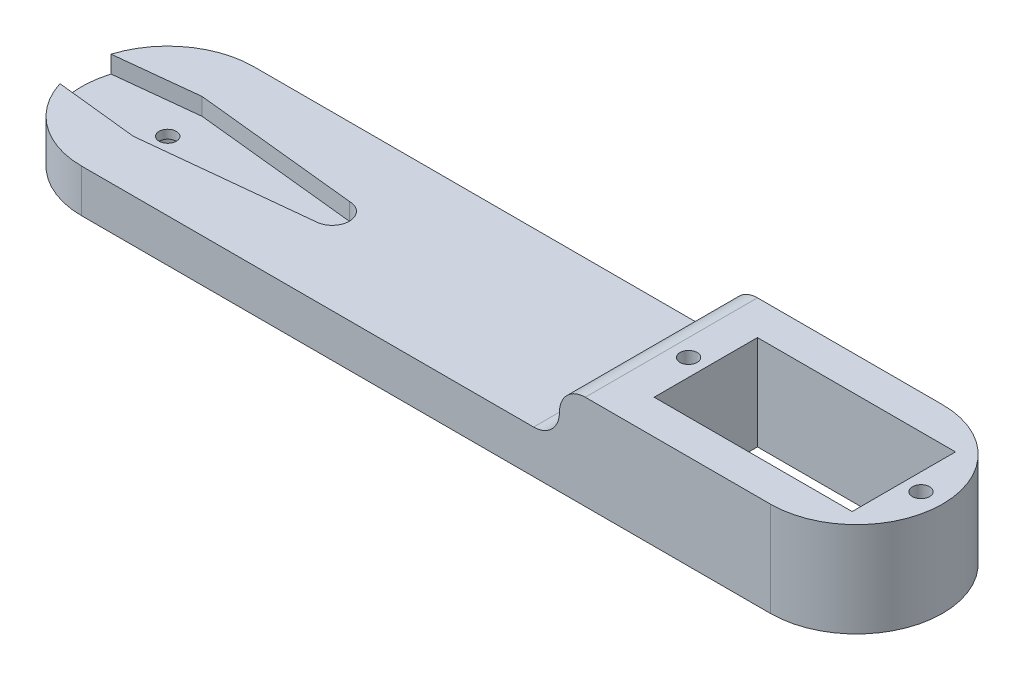
from build123d import *

# Parameters (mm, degrees)
BOSS_EXTRUDE1_DEPTH = 5
CUT_EXTRUDE1_START  = -2
CUT_EXTRUDE1_DEPTH  = 2
CUT_EXTRUDE2_DEPTH  = 52.23475383
SKETCH4_R           = 3
CUT_EXTRUDE3_DEPTH  = 2
SKETCH5_W           = 17.5
SKETCH5_H           = 12
SKETCH5_W_2         = 5.5
SKETCH5_R           = 1
CUT_EXTRUDE4_DEPTH  = 52.23475383
BOSS_EXTRUDE2_START = 6
SKETCH6_R           = 1
SKETCH6_W           = 23
SKETCH6_H           = 12
BOSS_EXTRUDE2_DEPTH = 6
FILLET1_R           = 3
FILLET2_R           = 3
SKETCH7_R           = 1.5
CUT_EXTRUDE5_DEPTH  = 4
SKETCH8_R           = 1.75
CUT_EXTRUDE6_DEPTH  = 10


with BuildPart() as part:
    # Sketch1 → Boss-Extrude1 (new body)
    with BuildSketch(Plane(origin=(0, 0, 0), x_dir=(1, 0, 0), z_dir=(0, 1, 0))):
        with BuildLine():
            Line((-40, 10), (40, 10))
            ThreePointArc((40, 10), (50, 0), (40, -10))
            Line((40, -10), (-40, -10))
            ThreePointArc((-40, -10), (-50, 0), (-40, 10))
        make_face()
    extrude(amount=BOSS_EXTRUDE1_DEPTH)

    # Sketch2 → Cut-Extrude1 (cut)
    with BuildSketch(Plane(origin=(0, 5, 0), x_dir=(1, 0, 0), z_dir=(0, 1, 0)).offset(CUT_EXTRUDE1_START)):
        with BuildLine():
            Line((-39.171140726, 3.913181864), (-40, 4))
            Line((-40, 4), (-40.854873646, 3.907581227))
            Line((-40.854873646, 3.907581227), (-49.549514718, 2.96762003))
            ThreePointArc((-49.549514718, 2.96762003), (-50, 0), (-49.549514718, -2.96762003))
            Line((-49.549514718, -2.96762003), (-40.854873646, -3.907581227))
            Line((-40.854873646, -3.907581227), (-40, -4))
            Line((-40, -4), (-39.171140726, -3.913181864))
            Line((-39.171140726, -3.913181864), (-20.905849501, -2))
            ThreePointArc((-20.905849501, -2), (-18.905849501, 0), (-20.905849501, 2))
            Line((-20.905849501, 2), (-39.171140726, 3.913181864))
        make_face()
    extrude(amount=CUT_EXTRUDE1_DEPTH, mode=Mode.SUBTRACT)

    # Sketch3 → Cut-Extrude2 (cut, through all)
    with BuildSketch(Plane(origin=(0, 5, 0), x_dir=(1, 0, 0), z_dir=(0, 1, 0))):
        with BuildLine():
            ThreePointArc((-39, 0), (-39.292893219, 0.707106781), (-40, 1))
            Line((-40, 1), (-40, -1))
            ThreePointArc((-40, -1), (-39.292893219, -0.707106781), (-39, 0))
        make_face()
        with BuildLine():
            Line((-40, -1), (-40, 1))
            ThreePointArc((-40, 1), (-41, 0), (-40, -1))
        make_face()
    extrude(amount=-CUT_EXTRUDE2_DEPTH, mode=Mode.SUBTRACT)

    # Sketch4 → Cut-Extrude3 (cut)
    with BuildSketch(Plane.XZ):
        with Locations(Location((-40, 0, 0), (0, 0, 270))):
            Circle(SKETCH4_R)
    extrude(amount=-CUT_EXTRUDE3_DEPTH, mode=Mode.SUBTRACT)

    # Sketch5 → Cut-Extrude4 (cut, through all)
    with BuildSketch(Plane(origin=(0, 5, 0), x_dir=(1, 0, 0), z_dir=(0, 1, 0))):
        with Locations((31.25, 0)):
            Rectangle(SKETCH5_W, SKETCH5_H)
        with Locations((42.75, 0)):
            Rectangle(SKETCH5_W_2, SKETCH5_H)
        with Locations(Location((47.5, 0, 0), (0, 0, 270))):
            Circle(SKETCH5_R)
        with Locations(Location((20.5, 0, 0), (0, 0, 270))):
            Circle(SKETCH5_R)
    extrude(amount=-CUT_EXTRUDE4_DEPTH, mode=Mode.SUBTRACT)

    # Sketch6 → Boss-Extrude2 (add)
    with BuildSketch(Plane(origin=(0, 5, 0), x_dir=(1, 0, 0), z_dir=(0, 1, 0)).offset(BOSS_EXTRUDE2_START)):
        with BuildLine():
            Line((15.501327646, 10), (15.501327646, -10))
            Line((15.501327646, -10), (40, -10))
            ThreePointArc((40, -10), (50, 0), (40, 10))
            Line((40, 10), (15.501327646, 10))
        make_face()
        with Locations(Location((20.5, 0, 0), (0, 0, 270))):
            Circle(SKETCH6_R, mode=Mode.SUBTRACT)
        with Locations(Location((47.5, 0, 0), (0, 0, 270))):
            Circle(SKETCH6_R, mode=Mode.SUBTRACT)
        with Locations((34, 0)):
            Rectangle(SKETCH6_W, SKETCH6_H, mode=Mode.SUBTRACT)
    extrude(amount=-BOSS_EXTRUDE2_DEPTH)

    # Fillet1
    fillet1_edges = [part.edges().sort_by_distance(p)[0] for p in [
        (15.501327646, 11, 0),
    ]]
    fillet(fillet1_edges, radius=FILLET1_R)

    # Fillet2
    fillet2_edges = [part.edges().sort_by_distance(p)[0] for p in [
        (15.501327646, 5, 0),
    ]]
    fillet(fillet2_edges, radius=FILLET2_R - 0.0001)  # a hair under: the kernel refuses the full size

    # Sketch7 → Cut-Extrude5 (cut)
    with BuildSketch(Plane.XZ):
        with Locations(Location((20.5, 0, 0), (0, 0, 270))):
            Circle(SKETCH7_R)
        with Locations(Location((47.5, 0, 0), (0, 0, 270))):
            Circle(SKETCH7_R)
    extrude(amount=-CUT_EXTRUDE5_DEPTH, mode=Mode.SUBTRACT)

    # Sketch8 → Cut-Extrude6 (cut)
    with BuildSketch(Plane(origin=(0, 0, -10), x_dir=(-1, 0, 0), z_dir=(0, 0, -1))):
        with Locations((0, 2.5)):
            Circle(SKETCH8_R)
    extrude(amount=-CUT_EXTRUDE6_DEPTH, mode=Mode.SUBTRACT)


solid = part.part
